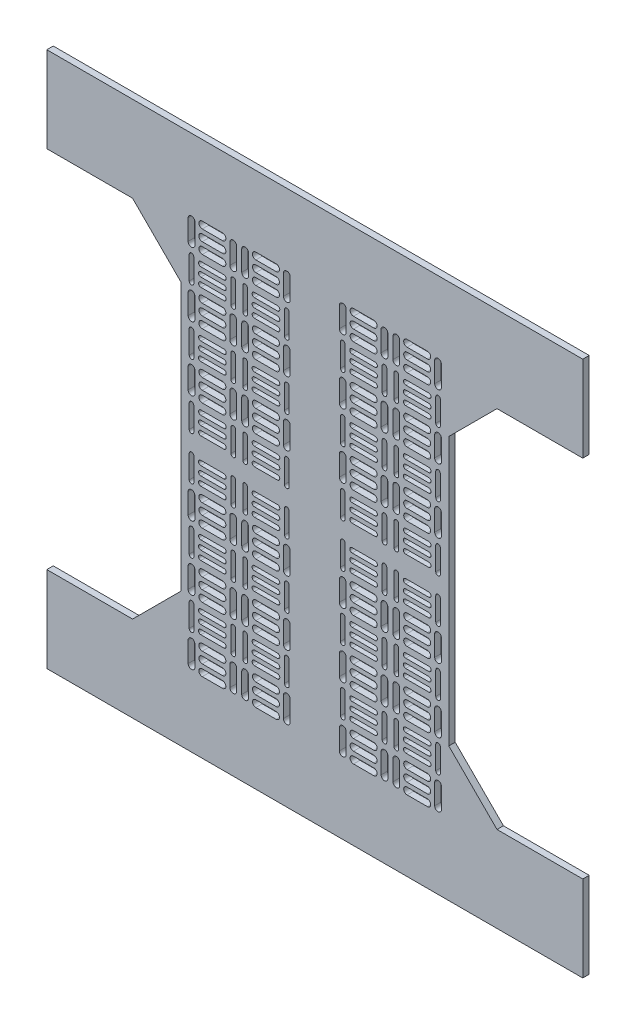
from build123d import *

# Parameters (mm, degrees)
BOSS_EXTRU_1_DEPTH              = 3
ENL_V_MAT_EXTRU_1_DEPTH         = 177.802149308
R_P_TITION_LIN_AIRE1_COUNT      = 2
R_P_TITION_LIN_AIRE1_PITCH      = 25
R_P_TITION_LIN_AIRE1_COUNT_DIR2 = 3
R_P_TITION_LIN_AIRE1_PITCH_DIR2 = 30
SYM_TRIE1_COPY_1_DEPTH          = 177.802149308
SYM_TRIE1_COPY_2_DEPTH          = 177.802149308
SYM_TRIE1_COPY_3_DEPTH          = 177.802149308
SYM_TRIE1_COPY_4_DEPTH          = 177.802149308
SYM_TRIE1_COPY_5_DEPTH          = 177.802149308
SYM_TRIE2_COPY_1_DEPTH          = 177.802149308
SYM_TRIE2_COPY_2_DEPTH          = 177.802149308
SYM_TRIE2_COPY_3_DEPTH          = 177.802149308
SYM_TRIE2_COPY_4_DEPTH          = 177.802149308
SYM_TRIE2_COPY_5_DEPTH          = 177.802149308
SYM_TRIE2_COPY_6_DEPTH          = 3
SYM_TRIE2_COPY_7_DEPTH          = 177.802149308
SYM_TRIE2_COPY_8_DEPTH          = 177.802149308
SYM_TRIE2_COPY_9_DEPTH          = 177.802149308
SYM_TRIE2_COPY_10_DEPTH         = 177.802149308
SYM_TRIE2_COPY_11_DEPTH         = 177.802149308
SYM_TRIE2_COPY_12_DEPTH         = 177.802149308


with BuildPart() as part:
    # Esquisse1 → Boss.-Extru.1 (new body)
    with BuildSketch(Plane.XY):
        Polygon((0, 0), (0, 125), (125, 125), (125, 85), (85, 85), (62.5, 62.5), (62.5, 0), align=None)
    boss_extru_1 = extrude(amount=BOSS_EXTRU_1_DEPTH)

    # Esquisse2 → Enlèv. mat.-Extru.1 (cut, symmetric)
    with BuildSketch(Plane.XY.offset(3)):
        with BuildLine():
            Line((43.05, 83.7), (52.5, 83.7))
            ThreePointArc((52.5, 83.7), (54.075, 85.275), (52.5, 86.85))
            Line((52.5, 86.85), (43.05, 86.85))
            ThreePointArc((43.05, 86.85), (41.475, 85.275), (43.05, 83.7))
        make_face()
        with BuildLine():
            Line((43.05, 92), (52.5, 92))
            ThreePointArc((52.5, 92), (54.075, 90.425), (52.5, 88.85))
            Line((52.5, 88.85), (43.05, 88.85))
            ThreePointArc((43.05, 88.85), (41.475, 90.425), (43.05, 92))
        make_face()
        with BuildLine():
            Line((59.075, 90), (59.075, 80.55))
            ThreePointArc((59.075, 80.55), (57.5, 78.975), (55.925, 80.55))
            Line((55.925, 80.55), (55.925, 90))
            ThreePointArc((55.925, 90), (57.5, 91.575), (59.075, 90))
        make_face()
        with BuildLine():
            Line((43.05, 78.55), (52.5, 78.55))
            ThreePointArc((52.5, 78.55), (54.075, 80.125), (52.5, 81.7))
            Line((52.5, 81.7), (43.05, 81.7))
            ThreePointArc((43.05, 81.7), (41.475, 80.125), (43.05, 78.55))
        make_face()
        with BuildLine():
            Line((42.4, 75.4), (53.15, 75.4))
            ThreePointArc((53.15, 75.4), (54.225, 74.325), (53.15, 73.25))
            Line((53.15, 73.25), (42.4, 73.25))
            ThreePointArc((42.4, 73.25), (41.325, 74.325), (42.4, 75.4))
        make_face()
        with BuildLine():
            Line((36.475, 90), (36.475, 80.55))
            ThreePointArc((36.475, 80.55), (38.05, 78.975), (39.625, 80.55))
            Line((39.625, 80.55), (39.625, 90))
            ThreePointArc((39.625, 90), (38.05, 91.575), (36.475, 90))
        make_face()
        with BuildLine():
            Line((56.425, 75.55), (56.425, 64.8))
            ThreePointArc((56.425, 64.8), (57.5, 63.725), (58.575, 64.8))
            Line((58.575, 64.8), (58.575, 75.55))
            ThreePointArc((58.575, 75.55), (57.5, 76.625), (56.425, 75.55))
        make_face()
        with BuildLine():
            Line((42.4, 69.1), (53.15, 69.1))
            ThreePointArc((53.15, 69.1), (54.225, 70.175), (53.15, 71.25))
            Line((53.15, 71.25), (42.4, 71.25))
            ThreePointArc((42.4, 71.25), (41.325, 70.175), (42.4, 69.1))
        make_face()
        with BuildLine():
            Line((42.4, 64.95), (53.15, 64.95))
            ThreePointArc((53.15, 64.95), (54.225, 66.025), (53.15, 67.1))
            Line((53.15, 67.1), (42.4, 67.1))
            ThreePointArc((42.4, 67.1), (41.325, 66.025), (42.4, 64.95))
        make_face()
        with BuildLine():
            Line((39.125, 75.55), (39.125, 64.8))
            ThreePointArc((39.125, 64.8), (38.05, 63.725), (36.975, 64.8))
            Line((36.975, 64.8), (36.975, 75.55))
            ThreePointArc((36.975, 75.55), (38.05, 76.625), (39.125, 75.55))
        make_face()
    enl_v_mat_extru_1 = extrude(amount=ENL_V_MAT_EXTRU_1_DEPTH, both=True, mode=Mode.SUBTRACT)

    # Répétition linéaire1: Enl_v. mat.-Extru.1 2 × 3
    with Locations(*[(-i * R_P_TITION_LIN_AIRE1_PITCH, -j * R_P_TITION_LIN_AIRE1_PITCH_DIR2, 0) for i in range(R_P_TITION_LIN_AIRE1_COUNT) for j in range(R_P_TITION_LIN_AIRE1_COUNT_DIR2) if (i, j) != (0, 0)]):
        add(enl_v_mat_extru_1, mode=Mode.SUBTRACT)

    # Symétrie1: Boss.-Extru.1, Enlèv. mat.-Extru.1 across plane
    add(boss_extru_1.mirror(Plane.ZX))
    add(enl_v_mat_extru_1.mirror(Plane.ZX), mode=Mode.SUBTRACT)

    # Symétrie1 copy 1 sketch → Symétrie1 copy 1 (cut, symmetric)
    with BuildSketch(Plane(origin=(0, 30, 3), x_dir=(1, 0, 0), z_dir=(0, 0, 1))):
        with BuildLine():
            Line((43.05, -83.7), (52.5, -83.7))
            ThreePointArc((52.5, -83.7), (54.075, -85.275), (52.5, -86.85))
            Line((52.5, -86.85), (43.05, -86.85))
            ThreePointArc((43.05, -86.85), (41.475, -85.275), (43.05, -83.7))
        make_face()
        with BuildLine():
            Line((43.05, -92), (52.5, -92))
            ThreePointArc((52.5, -92), (54.075, -90.425), (52.5, -88.85))
            Line((52.5, -88.85), (43.05, -88.85))
            ThreePointArc((43.05, -88.85), (41.475, -90.425), (43.05, -92))
        make_face()
        with BuildLine():
            Line((59.075, -90), (59.075, -80.55))
            ThreePointArc((59.075, -80.55), (57.5, -78.975), (55.925, -80.55))
            Line((55.925, -80.55), (55.925, -90))
            ThreePointArc((55.925, -90), (57.5, -91.575), (59.075, -90))
        make_face()
        with BuildLine():
            Line((43.05, -78.55), (52.5, -78.55))
            ThreePointArc((52.5, -78.55), (54.075, -80.125), (52.5, -81.7))
            Line((52.5, -81.7), (43.05, -81.7))
            ThreePointArc((43.05, -81.7), (41.475, -80.125), (43.05, -78.55))
        make_face()
        with BuildLine():
            Line((42.4, -75.4), (53.15, -75.4))
            ThreePointArc((53.15, -75.4), (54.225, -74.325), (53.15, -73.25))
            Line((53.15, -73.25), (42.4, -73.25))
            ThreePointArc((42.4, -73.25), (41.325, -74.325), (42.4, -75.4))
        make_face()
        with BuildLine():
            Line((36.475, -90), (36.475, -80.55))
            ThreePointArc((36.475, -80.55), (38.05, -78.975), (39.625, -80.55))
            Line((39.625, -80.55), (39.625, -90))
            ThreePointArc((39.625, -90), (38.05, -91.575), (36.475, -90))
        make_face()
        with BuildLine():
            Line((56.425, -75.55), (56.425, -64.8))
            ThreePointArc((56.425, -64.8), (57.5, -63.725), (58.575, -64.8))
            Line((58.575, -64.8), (58.575, -75.55))
            ThreePointArc((58.575, -75.55), (57.5, -76.625), (56.425, -75.55))
        make_face()
        with BuildLine():
            Line((42.4, -69.1), (53.15, -69.1))
            ThreePointArc((53.15, -69.1), (54.225, -70.175), (53.15, -71.25))
            Line((53.15, -71.25), (42.4, -71.25))
            ThreePointArc((42.4, -71.25), (41.325, -70.175), (42.4, -69.1))
        make_face()
        with BuildLine():
            Line((42.4, -64.95), (53.15, -64.95))
            ThreePointArc((53.15, -64.95), (54.225, -66.025), (53.15, -67.1))
            Line((53.15, -67.1), (42.4, -67.1))
            ThreePointArc((42.4, -67.1), (41.325, -66.025), (42.4, -64.95))
        make_face()
        with BuildLine():
            Line((39.125, -75.55), (39.125, -64.8))
            ThreePointArc((39.125, -64.8), (38.05, -63.725), (36.975, -64.8))
            Line((36.975, -64.8), (36.975, -75.55))
            ThreePointArc((36.975, -75.55), (38.05, -76.625), (39.125, -75.55))
        make_face()
    extrude(amount=SYM_TRIE1_COPY_1_DEPTH, both=True, mode=Mode.SUBTRACT)

    # Symétrie1 copy 2 sketch → Symétrie1 copy 2 (cut, symmetric)
    with BuildSketch(Plane(origin=(0, 60, 3), x_dir=(1, 0, 0), z_dir=(0, 0, 1))):
        with BuildLine():
            Line((43.05, -83.7), (52.5, -83.7))
            ThreePointArc((52.5, -83.7), (54.075, -85.275), (52.5, -86.85))
            Line((52.5, -86.85), (43.05, -86.85))
            ThreePointArc((43.05, -86.85), (41.475, -85.275), (43.05, -83.7))
        make_face()
        with BuildLine():
            Line((43.05, -92), (52.5, -92))
            ThreePointArc((52.5, -92), (54.075, -90.425), (52.5, -88.85))
            Line((52.5, -88.85), (43.05, -88.85))
            ThreePointArc((43.05, -88.85), (41.475, -90.425), (43.05, -92))
        make_face()
        with BuildLine():
            Line((59.075, -90), (59.075, -80.55))
            ThreePointArc((59.075, -80.55), (57.5, -78.975), (55.925, -80.55))
            Line((55.925, -80.55), (55.925, -90))
            ThreePointArc((55.925, -90), (57.5, -91.575), (59.075, -90))
        make_face()
        with BuildLine():
            Line((43.05, -78.55), (52.5, -78.55))
            ThreePointArc((52.5, -78.55), (54.075, -80.125), (52.5, -81.7))
            Line((52.5, -81.7), (43.05, -81.7))
            ThreePointArc((43.05, -81.7), (41.475, -80.125), (43.05, -78.55))
        make_face()
        with BuildLine():
            Line((42.4, -75.4), (53.15, -75.4))
            ThreePointArc((53.15, -75.4), (54.225, -74.325), (53.15, -73.25))
            Line((53.15, -73.25), (42.4, -73.25))
            ThreePointArc((42.4, -73.25), (41.325, -74.325), (42.4, -75.4))
        make_face()
        with BuildLine():
            Line((36.475, -90), (36.475, -80.55))
            ThreePointArc((36.475, -80.55), (38.05, -78.975), (39.625, -80.55))
            Line((39.625, -80.55), (39.625, -90))
            ThreePointArc((39.625, -90), (38.05, -91.575), (36.475, -90))
        make_face()
        with BuildLine():
            Line((56.425, -75.55), (56.425, -64.8))
            ThreePointArc((56.425, -64.8), (57.5, -63.725), (58.575, -64.8))
            Line((58.575, -64.8), (58.575, -75.55))
            ThreePointArc((58.575, -75.55), (57.5, -76.625), (56.425, -75.55))
        make_face()
        with BuildLine():
            Line((42.4, -69.1), (53.15, -69.1))
            ThreePointArc((53.15, -69.1), (54.225, -70.175), (53.15, -71.25))
            Line((53.15, -71.25), (42.4, -71.25))
            ThreePointArc((42.4, -71.25), (41.325, -70.175), (42.4, -69.1))
        make_face()
        with BuildLine():
            Line((42.4, -64.95), (53.15, -64.95))
            ThreePointArc((53.15, -64.95), (54.225, -66.025), (53.15, -67.1))
            Line((53.15, -67.1), (42.4, -67.1))
            ThreePointArc((42.4, -67.1), (41.325, -66.025), (42.4, -64.95))
        make_face()
        with BuildLine():
            Line((39.125, -75.55), (39.125, -64.8))
            ThreePointArc((39.125, -64.8), (38.05, -63.725), (36.975, -64.8))
            Line((36.975, -64.8), (36.975, -75.55))
            ThreePointArc((36.975, -75.55), (38.05, -76.625), (39.125, -75.55))
        make_face()
    extrude(amount=SYM_TRIE1_COPY_2_DEPTH, both=True, mode=Mode.SUBTRACT)

    # Symétrie1 copy 3 sketch → Symétrie1 copy 3 (cut, symmetric)
    with BuildSketch(Plane(origin=(-25, 0, 3), x_dir=(1, 0, 0), z_dir=(0, 0, 1))):
        with BuildLine():
            Line((43.05, -83.7), (52.5, -83.7))
            ThreePointArc((52.5, -83.7), (54.075, -85.275), (52.5, -86.85))
            Line((52.5, -86.85), (43.05, -86.85))
            ThreePointArc((43.05, -86.85), (41.475, -85.275), (43.05, -83.7))
        make_face()
        with BuildLine():
            Line((43.05, -92), (52.5, -92))
            ThreePointArc((52.5, -92), (54.075, -90.425), (52.5, -88.85))
            Line((52.5, -88.85), (43.05, -88.85))
            ThreePointArc((43.05, -88.85), (41.475, -90.425), (43.05, -92))
        make_face()
        with BuildLine():
            Line((59.075, -90), (59.075, -80.55))
            ThreePointArc((59.075, -80.55), (57.5, -78.975), (55.925, -80.55))
            Line((55.925, -80.55), (55.925, -90))
            ThreePointArc((55.925, -90), (57.5, -91.575), (59.075, -90))
        make_face()
        with BuildLine():
            Line((43.05, -78.55), (52.5, -78.55))
            ThreePointArc((52.5, -78.55), (54.075, -80.125), (52.5, -81.7))
            Line((52.5, -81.7), (43.05, -81.7))
            ThreePointArc((43.05, -81.7), (41.475, -80.125), (43.05, -78.55))
        make_face()
        with BuildLine():
            Line((42.4, -75.4), (53.15, -75.4))
            ThreePointArc((53.15, -75.4), (54.225, -74.325), (53.15, -73.25))
            Line((53.15, -73.25), (42.4, -73.25))
            ThreePointArc((42.4, -73.25), (41.325, -74.325), (42.4, -75.4))
        make_face()
        with BuildLine():
            Line((36.475, -90), (36.475, -80.55))
            ThreePointArc((36.475, -80.55), (38.05, -78.975), (39.625, -80.55))
            Line((39.625, -80.55), (39.625, -90))
            ThreePointArc((39.625, -90), (38.05, -91.575), (36.475, -90))
        make_face()
        with BuildLine():
            Line((56.425, -75.55), (56.425, -64.8))
            ThreePointArc((56.425, -64.8), (57.5, -63.725), (58.575, -64.8))
            Line((58.575, -64.8), (58.575, -75.55))
            ThreePointArc((58.575, -75.55), (57.5, -76.625), (56.425, -75.55))
        make_face()
        with BuildLine():
            Line((42.4, -69.1), (53.15, -69.1))
            ThreePointArc((53.15, -69.1), (54.225, -70.175), (53.15, -71.25))
            Line((53.15, -71.25), (42.4, -71.25))
            ThreePointArc((42.4, -71.25), (41.325, -70.175), (42.4, -69.1))
        make_face()
        with BuildLine():
            Line((42.4, -64.95), (53.15, -64.95))
            ThreePointArc((53.15, -64.95), (54.225, -66.025), (53.15, -67.1))
            Line((53.15, -67.1), (42.4, -67.1))
            ThreePointArc((42.4, -67.1), (41.325, -66.025), (42.4, -64.95))
        make_face()
        with BuildLine():
            Line((39.125, -75.55), (39.125, -64.8))
            ThreePointArc((39.125, -64.8), (38.05, -63.725), (36.975, -64.8))
            Line((36.975, -64.8), (36.975, -75.55))
            ThreePointArc((36.975, -75.55), (38.05, -76.625), (39.125, -75.55))
        make_face()
    extrude(amount=SYM_TRIE1_COPY_3_DEPTH, both=True, mode=Mode.SUBTRACT)

    # Symétrie1 copy 4 sketch → Symétrie1 copy 4 (cut, symmetric)
    with BuildSketch(Plane(origin=(-25, 30, 3), x_dir=(1, 0, 0), z_dir=(0, 0, 1))):
        with BuildLine():
            Line((43.05, -83.7), (52.5, -83.7))
            ThreePointArc((52.5, -83.7), (54.075, -85.275), (52.5, -86.85))
            Line((52.5, -86.85), (43.05, -86.85))
            ThreePointArc((43.05, -86.85), (41.475, -85.275), (43.05, -83.7))
        make_face()
        with BuildLine():
            Line((43.05, -92), (52.5, -92))
            ThreePointArc((52.5, -92), (54.075, -90.425), (52.5, -88.85))
            Line((52.5, -88.85), (43.05, -88.85))
            ThreePointArc((43.05, -88.85), (41.475, -90.425), (43.05, -92))
        make_face()
        with BuildLine():
            Line((59.075, -90), (59.075, -80.55))
            ThreePointArc((59.075, -80.55), (57.5, -78.975), (55.925, -80.55))
            Line((55.925, -80.55), (55.925, -90))
            ThreePointArc((55.925, -90), (57.5, -91.575), (59.075, -90))
        make_face()
        with BuildLine():
            Line((43.05, -78.55), (52.5, -78.55))
            ThreePointArc((52.5, -78.55), (54.075, -80.125), (52.5, -81.7))
            Line((52.5, -81.7), (43.05, -81.7))
            ThreePointArc((43.05, -81.7), (41.475, -80.125), (43.05, -78.55))
        make_face()
        with BuildLine():
            Line((42.4, -75.4), (53.15, -75.4))
            ThreePointArc((53.15, -75.4), (54.225, -74.325), (53.15, -73.25))
            Line((53.15, -73.25), (42.4, -73.25))
            ThreePointArc((42.4, -73.25), (41.325, -74.325), (42.4, -75.4))
        make_face()
        with BuildLine():
            Line((36.475, -90), (36.475, -80.55))
            ThreePointArc((36.475, -80.55), (38.05, -78.975), (39.625, -80.55))
            Line((39.625, -80.55), (39.625, -90))
            ThreePointArc((39.625, -90), (38.05, -91.575), (36.475, -90))
        make_face()
        with BuildLine():
            Line((56.425, -75.55), (56.425, -64.8))
            ThreePointArc((56.425, -64.8), (57.5, -63.725), (58.575, -64.8))
            Line((58.575, -64.8), (58.575, -75.55))
            ThreePointArc((58.575, -75.55), (57.5, -76.625), (56.425, -75.55))
        make_face()
        with BuildLine():
            Line((42.4, -69.1), (53.15, -69.1))
            ThreePointArc((53.15, -69.1), (54.225, -70.175), (53.15, -71.25))
            Line((53.15, -71.25), (42.4, -71.25))
            ThreePointArc((42.4, -71.25), (41.325, -70.175), (42.4, -69.1))
        make_face()
        with BuildLine():
            Line((42.4, -64.95), (53.15, -64.95))
            ThreePointArc((53.15, -64.95), (54.225, -66.025), (53.15, -67.1))
            Line((53.15, -67.1), (42.4, -67.1))
            ThreePointArc((42.4, -67.1), (41.325, -66.025), (42.4, -64.95))
        make_face()
        with BuildLine():
            Line((39.125, -75.55), (39.125, -64.8))
            ThreePointArc((39.125, -64.8), (38.05, -63.725), (36.975, -64.8))
            Line((36.975, -64.8), (36.975, -75.55))
            ThreePointArc((36.975, -75.55), (38.05, -76.625), (39.125, -75.55))
        make_face()
    extrude(amount=SYM_TRIE1_COPY_4_DEPTH, both=True, mode=Mode.SUBTRACT)

    # Symétrie1 copy 5 sketch → Symétrie1 copy 5 (cut, symmetric)
    with BuildSketch(Plane(origin=(-25, 60, 3), x_dir=(1, 0, 0), z_dir=(0, 0, 1))):
        with BuildLine():
            Line((43.05, -83.7), (52.5, -83.7))
            ThreePointArc((52.5, -83.7), (54.075, -85.275), (52.5, -86.85))
            Line((52.5, -86.85), (43.05, -86.85))
            ThreePointArc((43.05, -86.85), (41.475, -85.275), (43.05, -83.7))
        make_face()
        with BuildLine():
            Line((43.05, -92), (52.5, -92))
            ThreePointArc((52.5, -92), (54.075, -90.425), (52.5, -88.85))
            Line((52.5, -88.85), (43.05, -88.85))
            ThreePointArc((43.05, -88.85), (41.475, -90.425), (43.05, -92))
        make_face()
        with BuildLine():
            Line((59.075, -90), (59.075, -80.55))
            ThreePointArc((59.075, -80.55), (57.5, -78.975), (55.925, -80.55))
            Line((55.925, -80.55), (55.925, -90))
            ThreePointArc((55.925, -90), (57.5, -91.575), (59.075, -90))
        make_face()
        with BuildLine():
            Line((43.05, -78.55), (52.5, -78.55))
            ThreePointArc((52.5, -78.55), (54.075, -80.125), (52.5, -81.7))
            Line((52.5, -81.7), (43.05, -81.7))
            ThreePointArc((43.05, -81.7), (41.475, -80.125), (43.05, -78.55))
        make_face()
        with BuildLine():
            Line((42.4, -75.4), (53.15, -75.4))
            ThreePointArc((53.15, -75.4), (54.225, -74.325), (53.15, -73.25))
            Line((53.15, -73.25), (42.4, -73.25))
            ThreePointArc((42.4, -73.25), (41.325, -74.325), (42.4, -75.4))
        make_face()
        with BuildLine():
            Line((36.475, -90), (36.475, -80.55))
            ThreePointArc((36.475, -80.55), (38.05, -78.975), (39.625, -80.55))
            Line((39.625, -80.55), (39.625, -90))
            ThreePointArc((39.625, -90), (38.05, -91.575), (36.475, -90))
        make_face()
        with BuildLine():
            Line((56.425, -75.55), (56.425, -64.8))
            ThreePointArc((56.425, -64.8), (57.5, -63.725), (58.575, -64.8))
            Line((58.575, -64.8), (58.575, -75.55))
            ThreePointArc((58.575, -75.55), (57.5, -76.625), (56.425, -75.55))
        make_face()
        with BuildLine():
            Line((42.4, -69.1), (53.15, -69.1))
            ThreePointArc((53.15, -69.1), (54.225, -70.175), (53.15, -71.25))
            Line((53.15, -71.25), (42.4, -71.25))
            ThreePointArc((42.4, -71.25), (41.325, -70.175), (42.4, -69.1))
        make_face()
        with BuildLine():
            Line((42.4, -64.95), (53.15, -64.95))
            ThreePointArc((53.15, -64.95), (54.225, -66.025), (53.15, -67.1))
            Line((53.15, -67.1), (42.4, -67.1))
            ThreePointArc((42.4, -67.1), (41.325, -66.025), (42.4, -64.95))
        make_face()
        with BuildLine():
            Line((39.125, -75.55), (39.125, -64.8))
            ThreePointArc((39.125, -64.8), (38.05, -63.725), (36.975, -64.8))
            Line((36.975, -64.8), (36.975, -75.55))
            ThreePointArc((36.975, -75.55), (38.05, -76.625), (39.125, -75.55))
        make_face()
    extrude(amount=SYM_TRIE1_COPY_5_DEPTH, both=True, mode=Mode.SUBTRACT)

    # Symétrie2: Boss.-Extru.1, Enlèv. mat.-Extru.1 across plane
    add(boss_extru_1.mirror(Plane(origin=(0, 0, 0), x_dir=(0, 0, 1), z_dir=(1, 0, 0))))
    add(enl_v_mat_extru_1.mirror(Plane(origin=(0, 0, 0), x_dir=(0, 0, 1), z_dir=(1, 0, 0))), mode=Mode.SUBTRACT)

    # Symétrie2 copy 1 sketch → Symétrie2 copy 1 (cut, symmetric)
    with BuildSketch(Plane(origin=(0, -30, 3), x_dir=(-1, 0, 0), z_dir=(0, 0, 1))):
        with BuildLine():
            Line((43.05, -83.7), (52.5, -83.7))
            ThreePointArc((52.5, -83.7), (54.075, -85.275), (52.5, -86.85))
            Line((52.5, -86.85), (43.05, -86.85))
            ThreePointArc((43.05, -86.85), (41.475, -85.275), (43.05, -83.7))
        make_face()
        with BuildLine():
            Line((43.05, -92), (52.5, -92))
            ThreePointArc((52.5, -92), (54.075, -90.425), (52.5, -88.85))
            Line((52.5, -88.85), (43.05, -88.85))
            ThreePointArc((43.05, -88.85), (41.475, -90.425), (43.05, -92))
        make_face()
        with BuildLine():
            Line((59.075, -90), (59.075, -80.55))
            ThreePointArc((59.075, -80.55), (57.5, -78.975), (55.925, -80.55))
            Line((55.925, -80.55), (55.925, -90))
            ThreePointArc((55.925, -90), (57.5, -91.575), (59.075, -90))
        make_face()
        with BuildLine():
            Line((43.05, -78.55), (52.5, -78.55))
            ThreePointArc((52.5, -78.55), (54.075, -80.125), (52.5, -81.7))
            Line((52.5, -81.7), (43.05, -81.7))
            ThreePointArc((43.05, -81.7), (41.475, -80.125), (43.05, -78.55))
        make_face()
        with BuildLine():
            Line((42.4, -75.4), (53.15, -75.4))
            ThreePointArc((53.15, -75.4), (54.225, -74.325), (53.15, -73.25))
            Line((53.15, -73.25), (42.4, -73.25))
            ThreePointArc((42.4, -73.25), (41.325, -74.325), (42.4, -75.4))
        make_face()
        with BuildLine():
            Line((36.475, -90), (36.475, -80.55))
            ThreePointArc((36.475, -80.55), (38.05, -78.975), (39.625, -80.55))
            Line((39.625, -80.55), (39.625, -90))
            ThreePointArc((39.625, -90), (38.05, -91.575), (36.475, -90))
        make_face()
        with BuildLine():
            Line((56.425, -75.55), (56.425, -64.8))
            ThreePointArc((56.425, -64.8), (57.5, -63.725), (58.575, -64.8))
            Line((58.575, -64.8), (58.575, -75.55))
            ThreePointArc((58.575, -75.55), (57.5, -76.625), (56.425, -75.55))
        make_face()
        with BuildLine():
            Line((42.4, -69.1), (53.15, -69.1))
            ThreePointArc((53.15, -69.1), (54.225, -70.175), (53.15, -71.25))
            Line((53.15, -71.25), (42.4, -71.25))
            ThreePointArc((42.4, -71.25), (41.325, -70.175), (42.4, -69.1))
        make_face()
        with BuildLine():
            Line((42.4, -64.95), (53.15, -64.95))
            ThreePointArc((53.15, -64.95), (54.225, -66.025), (53.15, -67.1))
            Line((53.15, -67.1), (42.4, -67.1))
            ThreePointArc((42.4, -67.1), (41.325, -66.025), (42.4, -64.95))
        make_face()
        with BuildLine():
            Line((39.125, -75.55), (39.125, -64.8))
            ThreePointArc((39.125, -64.8), (38.05, -63.725), (36.975, -64.8))
            Line((36.975, -64.8), (36.975, -75.55))
            ThreePointArc((36.975, -75.55), (38.05, -76.625), (39.125, -75.55))
        make_face()
    extrude(amount=SYM_TRIE2_COPY_1_DEPTH, both=True, mode=Mode.SUBTRACT)

    # Symétrie2 copy 2 sketch → Symétrie2 copy 2 (cut, symmetric)
    with BuildSketch(Plane(origin=(0, -60, 3), x_dir=(-1, 0, 0), z_dir=(0, 0, 1))):
        with BuildLine():
            Line((43.05, -83.7), (52.5, -83.7))
            ThreePointArc((52.5, -83.7), (54.075, -85.275), (52.5, -86.85))
            Line((52.5, -86.85), (43.05, -86.85))
            ThreePointArc((43.05, -86.85), (41.475, -85.275), (43.05, -83.7))
        make_face()
        with BuildLine():
            Line((43.05, -92), (52.5, -92))
            ThreePointArc((52.5, -92), (54.075, -90.425), (52.5, -88.85))
            Line((52.5, -88.85), (43.05, -88.85))
            ThreePointArc((43.05, -88.85), (41.475, -90.425), (43.05, -92))
        make_face()
        with BuildLine():
            Line((59.075, -90), (59.075, -80.55))
            ThreePointArc((59.075, -80.55), (57.5, -78.975), (55.925, -80.55))
            Line((55.925, -80.55), (55.925, -90))
            ThreePointArc((55.925, -90), (57.5, -91.575), (59.075, -90))
        make_face()
        with BuildLine():
            Line((43.05, -78.55), (52.5, -78.55))
            ThreePointArc((52.5, -78.55), (54.075, -80.125), (52.5, -81.7))
            Line((52.5, -81.7), (43.05, -81.7))
            ThreePointArc((43.05, -81.7), (41.475, -80.125), (43.05, -78.55))
        make_face()
        with BuildLine():
            Line((42.4, -75.4), (53.15, -75.4))
            ThreePointArc((53.15, -75.4), (54.225, -74.325), (53.15, -73.25))
            Line((53.15, -73.25), (42.4, -73.25))
            ThreePointArc((42.4, -73.25), (41.325, -74.325), (42.4, -75.4))
        make_face()
        with BuildLine():
            Line((36.475, -90), (36.475, -80.55))
            ThreePointArc((36.475, -80.55), (38.05, -78.975), (39.625, -80.55))
            Line((39.625, -80.55), (39.625, -90))
            ThreePointArc((39.625, -90), (38.05, -91.575), (36.475, -90))
        make_face()
        with BuildLine():
            Line((56.425, -75.55), (56.425, -64.8))
            ThreePointArc((56.425, -64.8), (57.5, -63.725), (58.575, -64.8))
            Line((58.575, -64.8), (58.575, -75.55))
            ThreePointArc((58.575, -75.55), (57.5, -76.625), (56.425, -75.55))
        make_face()
        with BuildLine():
            Line((42.4, -69.1), (53.15, -69.1))
            ThreePointArc((53.15, -69.1), (54.225, -70.175), (53.15, -71.25))
            Line((53.15, -71.25), (42.4, -71.25))
            ThreePointArc((42.4, -71.25), (41.325, -70.175), (42.4, -69.1))
        make_face()
        with BuildLine():
            Line((42.4, -64.95), (53.15, -64.95))
            ThreePointArc((53.15, -64.95), (54.225, -66.025), (53.15, -67.1))
            Line((53.15, -67.1), (42.4, -67.1))
            ThreePointArc((42.4, -67.1), (41.325, -66.025), (42.4, -64.95))
        make_face()
        with BuildLine():
            Line((39.125, -75.55), (39.125, -64.8))
            ThreePointArc((39.125, -64.8), (38.05, -63.725), (36.975, -64.8))
            Line((36.975, -64.8), (36.975, -75.55))
            ThreePointArc((36.975, -75.55), (38.05, -76.625), (39.125, -75.55))
        make_face()
    extrude(amount=SYM_TRIE2_COPY_2_DEPTH, both=True, mode=Mode.SUBTRACT)

    # Symétrie2 copy 3 sketch → Symétrie2 copy 3 (cut, symmetric)
    with BuildSketch(Plane(origin=(25, 0, 3), x_dir=(-1, 0, 0), z_dir=(0, 0, 1))):
        with BuildLine():
            Line((43.05, -83.7), (52.5, -83.7))
            ThreePointArc((52.5, -83.7), (54.075, -85.275), (52.5, -86.85))
            Line((52.5, -86.85), (43.05, -86.85))
            ThreePointArc((43.05, -86.85), (41.475, -85.275), (43.05, -83.7))
        make_face()
        with BuildLine():
            Line((43.05, -92), (52.5, -92))
            ThreePointArc((52.5, -92), (54.075, -90.425), (52.5, -88.85))
            Line((52.5, -88.85), (43.05, -88.85))
            ThreePointArc((43.05, -88.85), (41.475, -90.425), (43.05, -92))
        make_face()
        with BuildLine():
            Line((59.075, -90), (59.075, -80.55))
            ThreePointArc((59.075, -80.55), (57.5, -78.975), (55.925, -80.55))
            Line((55.925, -80.55), (55.925, -90))
            ThreePointArc((55.925, -90), (57.5, -91.575), (59.075, -90))
        make_face()
        with BuildLine():
            Line((43.05, -78.55), (52.5, -78.55))
            ThreePointArc((52.5, -78.55), (54.075, -80.125), (52.5, -81.7))
            Line((52.5, -81.7), (43.05, -81.7))
            ThreePointArc((43.05, -81.7), (41.475, -80.125), (43.05, -78.55))
        make_face()
        with BuildLine():
            Line((42.4, -75.4), (53.15, -75.4))
            ThreePointArc((53.15, -75.4), (54.225, -74.325), (53.15, -73.25))
            Line((53.15, -73.25), (42.4, -73.25))
            ThreePointArc((42.4, -73.25), (41.325, -74.325), (42.4, -75.4))
        make_face()
        with BuildLine():
            Line((36.475, -90), (36.475, -80.55))
            ThreePointArc((36.475, -80.55), (38.05, -78.975), (39.625, -80.55))
            Line((39.625, -80.55), (39.625, -90))
            ThreePointArc((39.625, -90), (38.05, -91.575), (36.475, -90))
        make_face()
        with BuildLine():
            Line((56.425, -75.55), (56.425, -64.8))
            ThreePointArc((56.425, -64.8), (57.5, -63.725), (58.575, -64.8))
            Line((58.575, -64.8), (58.575, -75.55))
            ThreePointArc((58.575, -75.55), (57.5, -76.625), (56.425, -75.55))
        make_face()
        with BuildLine():
            Line((42.4, -69.1), (53.15, -69.1))
            ThreePointArc((53.15, -69.1), (54.225, -70.175), (53.15, -71.25))
            Line((53.15, -71.25), (42.4, -71.25))
            ThreePointArc((42.4, -71.25), (41.325, -70.175), (42.4, -69.1))
        make_face()
        with BuildLine():
            Line((42.4, -64.95), (53.15, -64.95))
            ThreePointArc((53.15, -64.95), (54.225, -66.025), (53.15, -67.1))
            Line((53.15, -67.1), (42.4, -67.1))
            ThreePointArc((42.4, -67.1), (41.325, -66.025), (42.4, -64.95))
        make_face()
        with BuildLine():
            Line((39.125, -75.55), (39.125, -64.8))
            ThreePointArc((39.125, -64.8), (38.05, -63.725), (36.975, -64.8))
            Line((36.975, -64.8), (36.975, -75.55))
            ThreePointArc((36.975, -75.55), (38.05, -76.625), (39.125, -75.55))
        make_face()
    extrude(amount=SYM_TRIE2_COPY_3_DEPTH, both=True, mode=Mode.SUBTRACT)

    # Symétrie2 copy 4 sketch → Symétrie2 copy 4 (cut, symmetric)
    with BuildSketch(Plane(origin=(25, -30, 3), x_dir=(-1, 0, 0), z_dir=(0, 0, 1))):
        with BuildLine():
            Line((43.05, -83.7), (52.5, -83.7))
            ThreePointArc((52.5, -83.7), (54.075, -85.275), (52.5, -86.85))
            Line((52.5, -86.85), (43.05, -86.85))
            ThreePointArc((43.05, -86.85), (41.475, -85.275), (43.05, -83.7))
        make_face()
        with BuildLine():
            Line((43.05, -92), (52.5, -92))
            ThreePointArc((52.5, -92), (54.075, -90.425), (52.5, -88.85))
            Line((52.5, -88.85), (43.05, -88.85))
            ThreePointArc((43.05, -88.85), (41.475, -90.425), (43.05, -92))
        make_face()
        with BuildLine():
            Line((59.075, -90), (59.075, -80.55))
            ThreePointArc((59.075, -80.55), (57.5, -78.975), (55.925, -80.55))
            Line((55.925, -80.55), (55.925, -90))
            ThreePointArc((55.925, -90), (57.5, -91.575), (59.075, -90))
        make_face()
        with BuildLine():
            Line((43.05, -78.55), (52.5, -78.55))
            ThreePointArc((52.5, -78.55), (54.075, -80.125), (52.5, -81.7))
            Line((52.5, -81.7), (43.05, -81.7))
            ThreePointArc((43.05, -81.7), (41.475, -80.125), (43.05, -78.55))
        make_face()
        with BuildLine():
            Line((42.4, -75.4), (53.15, -75.4))
            ThreePointArc((53.15, -75.4), (54.225, -74.325), (53.15, -73.25))
            Line((53.15, -73.25), (42.4, -73.25))
            ThreePointArc((42.4, -73.25), (41.325, -74.325), (42.4, -75.4))
        make_face()
        with BuildLine():
            Line((36.475, -90), (36.475, -80.55))
            ThreePointArc((36.475, -80.55), (38.05, -78.975), (39.625, -80.55))
            Line((39.625, -80.55), (39.625, -90))
            ThreePointArc((39.625, -90), (38.05, -91.575), (36.475, -90))
        make_face()
        with BuildLine():
            Line((56.425, -75.55), (56.425, -64.8))
            ThreePointArc((56.425, -64.8), (57.5, -63.725), (58.575, -64.8))
            Line((58.575, -64.8), (58.575, -75.55))
            ThreePointArc((58.575, -75.55), (57.5, -76.625), (56.425, -75.55))
        make_face()
        with BuildLine():
            Line((42.4, -69.1), (53.15, -69.1))
            ThreePointArc((53.15, -69.1), (54.225, -70.175), (53.15, -71.25))
            Line((53.15, -71.25), (42.4, -71.25))
            ThreePointArc((42.4, -71.25), (41.325, -70.175), (42.4, -69.1))
        make_face()
        with BuildLine():
            Line((42.4, -64.95), (53.15, -64.95))
            ThreePointArc((53.15, -64.95), (54.225, -66.025), (53.15, -67.1))
            Line((53.15, -67.1), (42.4, -67.1))
            ThreePointArc((42.4, -67.1), (41.325, -66.025), (42.4, -64.95))
        make_face()
        with BuildLine():
            Line((39.125, -75.55), (39.125, -64.8))
            ThreePointArc((39.125, -64.8), (38.05, -63.725), (36.975, -64.8))
            Line((36.975, -64.8), (36.975, -75.55))
            ThreePointArc((36.975, -75.55), (38.05, -76.625), (39.125, -75.55))
        make_face()
    extrude(amount=SYM_TRIE2_COPY_4_DEPTH, both=True, mode=Mode.SUBTRACT)

    # Symétrie2 copy 5 sketch → Symétrie2 copy 5 (cut, symmetric)
    with BuildSketch(Plane(origin=(25, -60, 3), x_dir=(-1, 0, 0), z_dir=(0, 0, 1))):
        with BuildLine():
            Line((43.05, -83.7), (52.5, -83.7))
            ThreePointArc((52.5, -83.7), (54.075, -85.275), (52.5, -86.85))
            Line((52.5, -86.85), (43.05, -86.85))
            ThreePointArc((43.05, -86.85), (41.475, -85.275), (43.05, -83.7))
        make_face()
        with BuildLine():
            Line((43.05, -92), (52.5, -92))
            ThreePointArc((52.5, -92), (54.075, -90.425), (52.5, -88.85))
            Line((52.5, -88.85), (43.05, -88.85))
            ThreePointArc((43.05, -88.85), (41.475, -90.425), (43.05, -92))
        make_face()
        with BuildLine():
            Line((59.075, -90), (59.075, -80.55))
            ThreePointArc((59.075, -80.55), (57.5, -78.975), (55.925, -80.55))
            Line((55.925, -80.55), (55.925, -90))
            ThreePointArc((55.925, -90), (57.5, -91.575), (59.075, -90))
        make_face()
        with BuildLine():
            Line((43.05, -78.55), (52.5, -78.55))
            ThreePointArc((52.5, -78.55), (54.075, -80.125), (52.5, -81.7))
            Line((52.5, -81.7), (43.05, -81.7))
            ThreePointArc((43.05, -81.7), (41.475, -80.125), (43.05, -78.55))
        make_face()
        with BuildLine():
            Line((42.4, -75.4), (53.15, -75.4))
            ThreePointArc((53.15, -75.4), (54.225, -74.325), (53.15, -73.25))
            Line((53.15, -73.25), (42.4, -73.25))
            ThreePointArc((42.4, -73.25), (41.325, -74.325), (42.4, -75.4))
        make_face()
        with BuildLine():
            Line((36.475, -90), (36.475, -80.55))
            ThreePointArc((36.475, -80.55), (38.05, -78.975), (39.625, -80.55))
            Line((39.625, -80.55), (39.625, -90))
            ThreePointArc((39.625, -90), (38.05, -91.575), (36.475, -90))
        make_face()
        with BuildLine():
            Line((56.425, -75.55), (56.425, -64.8))
            ThreePointArc((56.425, -64.8), (57.5, -63.725), (58.575, -64.8))
            Line((58.575, -64.8), (58.575, -75.55))
            ThreePointArc((58.575, -75.55), (57.5, -76.625), (56.425, -75.55))
        make_face()
        with BuildLine():
            Line((42.4, -69.1), (53.15, -69.1))
            ThreePointArc((53.15, -69.1), (54.225, -70.175), (53.15, -71.25))
            Line((53.15, -71.25), (42.4, -71.25))
            ThreePointArc((42.4, -71.25), (41.325, -70.175), (42.4, -69.1))
        make_face()
        with BuildLine():
            Line((42.4, -64.95), (53.15, -64.95))
            ThreePointArc((53.15, -64.95), (54.225, -66.025), (53.15, -67.1))
            Line((53.15, -67.1), (42.4, -67.1))
            ThreePointArc((42.4, -67.1), (41.325, -66.025), (42.4, -64.95))
        make_face()
        with BuildLine():
            Line((39.125, -75.55), (39.125, -64.8))
            ThreePointArc((39.125, -64.8), (38.05, -63.725), (36.975, -64.8))
            Line((36.975, -64.8), (36.975, -75.55))
            ThreePointArc((36.975, -75.55), (38.05, -76.625), (39.125, -75.55))
        make_face()
    extrude(amount=SYM_TRIE2_COPY_5_DEPTH, both=True, mode=Mode.SUBTRACT)

    # Symétrie2 copy 6 sketch → Symétrie2 copy 6 (add)
    with BuildSketch(Plane(origin=(0, 0, 0), x_dir=(-1, 0, 0), z_dir=(0, 0, 1))):
        Polygon((0, 0), (0, 125), (125, 125), (125, 85), (85, 85), (62.5, 62.5), (62.5, 0), align=None)
    extrude(amount=SYM_TRIE2_COPY_6_DEPTH)

    # Symétrie2 copy 7 sketch → Symétrie2 copy 7 (cut, symmetric)
    with BuildSketch(Plane(origin=(0, 0, 3), x_dir=(-1, 0, 0), z_dir=(0, 0, 1))):
        with BuildLine():
            Line((43.05, 83.7), (52.5, 83.7))
            ThreePointArc((52.5, 83.7), (54.075, 85.275), (52.5, 86.85))
            Line((52.5, 86.85), (43.05, 86.85))
            ThreePointArc((43.05, 86.85), (41.475, 85.275), (43.05, 83.7))
        make_face()
        with BuildLine():
            Line((43.05, 92), (52.5, 92))
            ThreePointArc((52.5, 92), (54.075, 90.425), (52.5, 88.85))
            Line((52.5, 88.85), (43.05, 88.85))
            ThreePointArc((43.05, 88.85), (41.475, 90.425), (43.05, 92))
        make_face()
        with BuildLine():
            Line((59.075, 90), (59.075, 80.55))
            ThreePointArc((59.075, 80.55), (57.5, 78.975), (55.925, 80.55))
            Line((55.925, 80.55), (55.925, 90))
            ThreePointArc((55.925, 90), (57.5, 91.575), (59.075, 90))
        make_face()
        with BuildLine():
            Line((43.05, 78.55), (52.5, 78.55))
            ThreePointArc((52.5, 78.55), (54.075, 80.125), (52.5, 81.7))
            Line((52.5, 81.7), (43.05, 81.7))
            ThreePointArc((43.05, 81.7), (41.475, 80.125), (43.05, 78.55))
        make_face()
        with BuildLine():
            Line((42.4, 75.4), (53.15, 75.4))
            ThreePointArc((53.15, 75.4), (54.225, 74.325), (53.15, 73.25))
            Line((53.15, 73.25), (42.4, 73.25))
            ThreePointArc((42.4, 73.25), (41.325, 74.325), (42.4, 75.4))
        make_face()
        with BuildLine():
            Line((36.475, 90), (36.475, 80.55))
            ThreePointArc((36.475, 80.55), (38.05, 78.975), (39.625, 80.55))
            Line((39.625, 80.55), (39.625, 90))
            ThreePointArc((39.625, 90), (38.05, 91.575), (36.475, 90))
        make_face()
        with BuildLine():
            Line((56.425, 75.55), (56.425, 64.8))
            ThreePointArc((56.425, 64.8), (57.5, 63.725), (58.575, 64.8))
            Line((58.575, 64.8), (58.575, 75.55))
            ThreePointArc((58.575, 75.55), (57.5, 76.625), (56.425, 75.55))
        make_face()
        with BuildLine():
            Line((42.4, 69.1), (53.15, 69.1))
            ThreePointArc((53.15, 69.1), (54.225, 70.175), (53.15, 71.25))
            Line((53.15, 71.25), (42.4, 71.25))
            ThreePointArc((42.4, 71.25), (41.325, 70.175), (42.4, 69.1))
        make_face()
        with BuildLine():
            Line((42.4, 64.95), (53.15, 64.95))
            ThreePointArc((53.15, 64.95), (54.225, 66.025), (53.15, 67.1))
            Line((53.15, 67.1), (42.4, 67.1))
            ThreePointArc((42.4, 67.1), (41.325, 66.025), (42.4, 64.95))
        make_face()
        with BuildLine():
            Line((39.125, 75.55), (39.125, 64.8))
            ThreePointArc((39.125, 64.8), (38.05, 63.725), (36.975, 64.8))
            Line((36.975, 64.8), (36.975, 75.55))
            ThreePointArc((36.975, 75.55), (38.05, 76.625), (39.125, 75.55))
        make_face()
    extrude(amount=SYM_TRIE2_COPY_7_DEPTH, both=True, mode=Mode.SUBTRACT)

    # Symétrie2 copy 8 sketch → Symétrie2 copy 8 (cut, symmetric)
    with BuildSketch(Plane(origin=(0, 30, 3), x_dir=(-1, 0, 0), z_dir=(0, 0, 1))):
        with BuildLine():
            Line((43.05, 83.7), (52.5, 83.7))
            ThreePointArc((52.5, 83.7), (54.075, 85.275), (52.5, 86.85))
            Line((52.5, 86.85), (43.05, 86.85))
            ThreePointArc((43.05, 86.85), (41.475, 85.275), (43.05, 83.7))
        make_face()
        with BuildLine():
            Line((43.05, 92), (52.5, 92))
            ThreePointArc((52.5, 92), (54.075, 90.425), (52.5, 88.85))
            Line((52.5, 88.85), (43.05, 88.85))
            ThreePointArc((43.05, 88.85), (41.475, 90.425), (43.05, 92))
        make_face()
        with BuildLine():
            Line((59.075, 90), (59.075, 80.55))
            ThreePointArc((59.075, 80.55), (57.5, 78.975), (55.925, 80.55))
            Line((55.925, 80.55), (55.925, 90))
            ThreePointArc((55.925, 90), (57.5, 91.575), (59.075, 90))
        make_face()
        with BuildLine():
            Line((43.05, 78.55), (52.5, 78.55))
            ThreePointArc((52.5, 78.55), (54.075, 80.125), (52.5, 81.7))
            Line((52.5, 81.7), (43.05, 81.7))
            ThreePointArc((43.05, 81.7), (41.475, 80.125), (43.05, 78.55))
        make_face()
        with BuildLine():
            Line((42.4, 75.4), (53.15, 75.4))
            ThreePointArc((53.15, 75.4), (54.225, 74.325), (53.15, 73.25))
            Line((53.15, 73.25), (42.4, 73.25))
            ThreePointArc((42.4, 73.25), (41.325, 74.325), (42.4, 75.4))
        make_face()
        with BuildLine():
            Line((36.475, 90), (36.475, 80.55))
            ThreePointArc((36.475, 80.55), (38.05, 78.975), (39.625, 80.55))
            Line((39.625, 80.55), (39.625, 90))
            ThreePointArc((39.625, 90), (38.05, 91.575), (36.475, 90))
        make_face()
        with BuildLine():
            Line((56.425, 75.55), (56.425, 64.8))
            ThreePointArc((56.425, 64.8), (57.5, 63.725), (58.575, 64.8))
            Line((58.575, 64.8), (58.575, 75.55))
            ThreePointArc((58.575, 75.55), (57.5, 76.625), (56.425, 75.55))
        make_face()
        with BuildLine():
            Line((42.4, 69.1), (53.15, 69.1))
            ThreePointArc((53.15, 69.1), (54.225, 70.175), (53.15, 71.25))
            Line((53.15, 71.25), (42.4, 71.25))
            ThreePointArc((42.4, 71.25), (41.325, 70.175), (42.4, 69.1))
        make_face()
        with BuildLine():
            Line((42.4, 64.95), (53.15, 64.95))
            ThreePointArc((53.15, 64.95), (54.225, 66.025), (53.15, 67.1))
            Line((53.15, 67.1), (42.4, 67.1))
            ThreePointArc((42.4, 67.1), (41.325, 66.025), (42.4, 64.95))
        make_face()
        with BuildLine():
            Line((39.125, 75.55), (39.125, 64.8))
            ThreePointArc((39.125, 64.8), (38.05, 63.725), (36.975, 64.8))
            Line((36.975, 64.8), (36.975, 75.55))
            ThreePointArc((36.975, 75.55), (38.05, 76.625), (39.125, 75.55))
        make_face()
    extrude(amount=SYM_TRIE2_COPY_8_DEPTH, both=True, mode=Mode.SUBTRACT)

    # Symétrie2 copy 9 sketch → Symétrie2 copy 9 (cut, symmetric)
    with BuildSketch(Plane(origin=(0, 60, 3), x_dir=(-1, 0, 0), z_dir=(0, 0, 1))):
        with BuildLine():
            Line((43.05, 83.7), (52.5, 83.7))
            ThreePointArc((52.5, 83.7), (54.075, 85.275), (52.5, 86.85))
            Line((52.5, 86.85), (43.05, 86.85))
            ThreePointArc((43.05, 86.85), (41.475, 85.275), (43.05, 83.7))
        make_face()
        with BuildLine():
            Line((43.05, 92), (52.5, 92))
            ThreePointArc((52.5, 92), (54.075, 90.425), (52.5, 88.85))
            Line((52.5, 88.85), (43.05, 88.85))
            ThreePointArc((43.05, 88.85), (41.475, 90.425), (43.05, 92))
        make_face()
        with BuildLine():
            Line((59.075, 90), (59.075, 80.55))
            ThreePointArc((59.075, 80.55), (57.5, 78.975), (55.925, 80.55))
            Line((55.925, 80.55), (55.925, 90))
            ThreePointArc((55.925, 90), (57.5, 91.575), (59.075, 90))
        make_face()
        with BuildLine():
            Line((43.05, 78.55), (52.5, 78.55))
            ThreePointArc((52.5, 78.55), (54.075, 80.125), (52.5, 81.7))
            Line((52.5, 81.7), (43.05, 81.7))
            ThreePointArc((43.05, 81.7), (41.475, 80.125), (43.05, 78.55))
        make_face()
        with BuildLine():
            Line((42.4, 75.4), (53.15, 75.4))
            ThreePointArc((53.15, 75.4), (54.225, 74.325), (53.15, 73.25))
            Line((53.15, 73.25), (42.4, 73.25))
            ThreePointArc((42.4, 73.25), (41.325, 74.325), (42.4, 75.4))
        make_face()
        with BuildLine():
            Line((36.475, 90), (36.475, 80.55))
            ThreePointArc((36.475, 80.55), (38.05, 78.975), (39.625, 80.55))
            Line((39.625, 80.55), (39.625, 90))
            ThreePointArc((39.625, 90), (38.05, 91.575), (36.475, 90))
        make_face()
        with BuildLine():
            Line((56.425, 75.55), (56.425, 64.8))
            ThreePointArc((56.425, 64.8), (57.5, 63.725), (58.575, 64.8))
            Line((58.575, 64.8), (58.575, 75.55))
            ThreePointArc((58.575, 75.55), (57.5, 76.625), (56.425, 75.55))
        make_face()
        with BuildLine():
            Line((42.4, 69.1), (53.15, 69.1))
            ThreePointArc((53.15, 69.1), (54.225, 70.175), (53.15, 71.25))
            Line((53.15, 71.25), (42.4, 71.25))
            ThreePointArc((42.4, 71.25), (41.325, 70.175), (42.4, 69.1))
        make_face()
        with BuildLine():
            Line((42.4, 64.95), (53.15, 64.95))
            ThreePointArc((53.15, 64.95), (54.225, 66.025), (53.15, 67.1))
            Line((53.15, 67.1), (42.4, 67.1))
            ThreePointArc((42.4, 67.1), (41.325, 66.025), (42.4, 64.95))
        make_face()
        with BuildLine():
            Line((39.125, 75.55), (39.125, 64.8))
            ThreePointArc((39.125, 64.8), (38.05, 63.725), (36.975, 64.8))
            Line((36.975, 64.8), (36.975, 75.55))
            ThreePointArc((36.975, 75.55), (38.05, 76.625), (39.125, 75.55))
        make_face()
    extrude(amount=SYM_TRIE2_COPY_9_DEPTH, both=True, mode=Mode.SUBTRACT)

    # Symétrie2 copy 10 sketch → Symétrie2 copy 10 (cut, symmetric)
    with BuildSketch(Plane(origin=(25, 0, 3), x_dir=(-1, 0, 0), z_dir=(0, 0, 1))):
        with BuildLine():
            Line((43.05, 83.7), (52.5, 83.7))
            ThreePointArc((52.5, 83.7), (54.075, 85.275), (52.5, 86.85))
            Line((52.5, 86.85), (43.05, 86.85))
            ThreePointArc((43.05, 86.85), (41.475, 85.275), (43.05, 83.7))
        make_face()
        with BuildLine():
            Line((43.05, 92), (52.5, 92))
            ThreePointArc((52.5, 92), (54.075, 90.425), (52.5, 88.85))
            Line((52.5, 88.85), (43.05, 88.85))
            ThreePointArc((43.05, 88.85), (41.475, 90.425), (43.05, 92))
        make_face()
        with BuildLine():
            Line((59.075, 90), (59.075, 80.55))
            ThreePointArc((59.075, 80.55), (57.5, 78.975), (55.925, 80.55))
            Line((55.925, 80.55), (55.925, 90))
            ThreePointArc((55.925, 90), (57.5, 91.575), (59.075, 90))
        make_face()
        with BuildLine():
            Line((43.05, 78.55), (52.5, 78.55))
            ThreePointArc((52.5, 78.55), (54.075, 80.125), (52.5, 81.7))
            Line((52.5, 81.7), (43.05, 81.7))
            ThreePointArc((43.05, 81.7), (41.475, 80.125), (43.05, 78.55))
        make_face()
        with BuildLine():
            Line((42.4, 75.4), (53.15, 75.4))
            ThreePointArc((53.15, 75.4), (54.225, 74.325), (53.15, 73.25))
            Line((53.15, 73.25), (42.4, 73.25))
            ThreePointArc((42.4, 73.25), (41.325, 74.325), (42.4, 75.4))
        make_face()
        with BuildLine():
            Line((36.475, 90), (36.475, 80.55))
            ThreePointArc((36.475, 80.55), (38.05, 78.975), (39.625, 80.55))
            Line((39.625, 80.55), (39.625, 90))
            ThreePointArc((39.625, 90), (38.05, 91.575), (36.475, 90))
        make_face()
        with BuildLine():
            Line((56.425, 75.55), (56.425, 64.8))
            ThreePointArc((56.425, 64.8), (57.5, 63.725), (58.575, 64.8))
            Line((58.575, 64.8), (58.575, 75.55))
            ThreePointArc((58.575, 75.55), (57.5, 76.625), (56.425, 75.55))
        make_face()
        with BuildLine():
            Line((42.4, 69.1), (53.15, 69.1))
            ThreePointArc((53.15, 69.1), (54.225, 70.175), (53.15, 71.25))
            Line((53.15, 71.25), (42.4, 71.25))
            ThreePointArc((42.4, 71.25), (41.325, 70.175), (42.4, 69.1))
        make_face()
        with BuildLine():
            Line((42.4, 64.95), (53.15, 64.95))
            ThreePointArc((53.15, 64.95), (54.225, 66.025), (53.15, 67.1))
            Line((53.15, 67.1), (42.4, 67.1))
            ThreePointArc((42.4, 67.1), (41.325, 66.025), (42.4, 64.95))
        make_face()
        with BuildLine():
            Line((39.125, 75.55), (39.125, 64.8))
            ThreePointArc((39.125, 64.8), (38.05, 63.725), (36.975, 64.8))
            Line((36.975, 64.8), (36.975, 75.55))
            ThreePointArc((36.975, 75.55), (38.05, 76.625), (39.125, 75.55))
        make_face()
    extrude(amount=SYM_TRIE2_COPY_10_DEPTH, both=True, mode=Mode.SUBTRACT)

    # Symétrie2 copy 11 sketch → Symétrie2 copy 11 (cut, symmetric)
    with BuildSketch(Plane(origin=(25, 30, 3), x_dir=(-1, 0, 0), z_dir=(0, 0, 1))):
        with BuildLine():
            Line((43.05, 83.7), (52.5, 83.7))
            ThreePointArc((52.5, 83.7), (54.075, 85.275), (52.5, 86.85))
            Line((52.5, 86.85), (43.05, 86.85))
            ThreePointArc((43.05, 86.85), (41.475, 85.275), (43.05, 83.7))
        make_face()
        with BuildLine():
            Line((43.05, 92), (52.5, 92))
            ThreePointArc((52.5, 92), (54.075, 90.425), (52.5, 88.85))
            Line((52.5, 88.85), (43.05, 88.85))
            ThreePointArc((43.05, 88.85), (41.475, 90.425), (43.05, 92))
        make_face()
        with BuildLine():
            Line((59.075, 90), (59.075, 80.55))
            ThreePointArc((59.075, 80.55), (57.5, 78.975), (55.925, 80.55))
            Line((55.925, 80.55), (55.925, 90))
            ThreePointArc((55.925, 90), (57.5, 91.575), (59.075, 90))
        make_face()
        with BuildLine():
            Line((43.05, 78.55), (52.5, 78.55))
            ThreePointArc((52.5, 78.55), (54.075, 80.125), (52.5, 81.7))
            Line((52.5, 81.7), (43.05, 81.7))
            ThreePointArc((43.05, 81.7), (41.475, 80.125), (43.05, 78.55))
        make_face()
        with BuildLine():
            Line((42.4, 75.4), (53.15, 75.4))
            ThreePointArc((53.15, 75.4), (54.225, 74.325), (53.15, 73.25))
            Line((53.15, 73.25), (42.4, 73.25))
            ThreePointArc((42.4, 73.25), (41.325, 74.325), (42.4, 75.4))
        make_face()
        with BuildLine():
            Line((36.475, 90), (36.475, 80.55))
            ThreePointArc((36.475, 80.55), (38.05, 78.975), (39.625, 80.55))
            Line((39.625, 80.55), (39.625, 90))
            ThreePointArc((39.625, 90), (38.05, 91.575), (36.475, 90))
        make_face()
        with BuildLine():
            Line((56.425, 75.55), (56.425, 64.8))
            ThreePointArc((56.425, 64.8), (57.5, 63.725), (58.575, 64.8))
            Line((58.575, 64.8), (58.575, 75.55))
            ThreePointArc((58.575, 75.55), (57.5, 76.625), (56.425, 75.55))
        make_face()
        with BuildLine():
            Line((42.4, 69.1), (53.15, 69.1))
            ThreePointArc((53.15, 69.1), (54.225, 70.175), (53.15, 71.25))
            Line((53.15, 71.25), (42.4, 71.25))
            ThreePointArc((42.4, 71.25), (41.325, 70.175), (42.4, 69.1))
        make_face()
        with BuildLine():
            Line((42.4, 64.95), (53.15, 64.95))
            ThreePointArc((53.15, 64.95), (54.225, 66.025), (53.15, 67.1))
            Line((53.15, 67.1), (42.4, 67.1))
            ThreePointArc((42.4, 67.1), (41.325, 66.025), (42.4, 64.95))
        make_face()
        with BuildLine():
            Line((39.125, 75.55), (39.125, 64.8))
            ThreePointArc((39.125, 64.8), (38.05, 63.725), (36.975, 64.8))
            Line((36.975, 64.8), (36.975, 75.55))
            ThreePointArc((36.975, 75.55), (38.05, 76.625), (39.125, 75.55))
        make_face()
    extrude(amount=SYM_TRIE2_COPY_11_DEPTH, both=True, mode=Mode.SUBTRACT)

    # Symétrie2 copy 12 sketch → Symétrie2 copy 12 (cut, symmetric)
    with BuildSketch(Plane(origin=(25, 60, 3), x_dir=(-1, 0, 0), z_dir=(0, 0, 1))):
        with BuildLine():
            Line((43.05, 83.7), (52.5, 83.7))
            ThreePointArc((52.5, 83.7), (54.075, 85.275), (52.5, 86.85))
            Line((52.5, 86.85), (43.05, 86.85))
            ThreePointArc((43.05, 86.85), (41.475, 85.275), (43.05, 83.7))
        make_face()
        with BuildLine():
            Line((43.05, 92), (52.5, 92))
            ThreePointArc((52.5, 92), (54.075, 90.425), (52.5, 88.85))
            Line((52.5, 88.85), (43.05, 88.85))
            ThreePointArc((43.05, 88.85), (41.475, 90.425), (43.05, 92))
        make_face()
        with BuildLine():
            Line((59.075, 90), (59.075, 80.55))
            ThreePointArc((59.075, 80.55), (57.5, 78.975), (55.925, 80.55))
            Line((55.925, 80.55), (55.925, 90))
            ThreePointArc((55.925, 90), (57.5, 91.575), (59.075, 90))
        make_face()
        with BuildLine():
            Line((43.05, 78.55), (52.5, 78.55))
            ThreePointArc((52.5, 78.55), (54.075, 80.125), (52.5, 81.7))
            Line((52.5, 81.7), (43.05, 81.7))
            ThreePointArc((43.05, 81.7), (41.475, 80.125), (43.05, 78.55))
        make_face()
        with BuildLine():
            Line((42.4, 75.4), (53.15, 75.4))
            ThreePointArc((53.15, 75.4), (54.225, 74.325), (53.15, 73.25))
            Line((53.15, 73.25), (42.4, 73.25))
            ThreePointArc((42.4, 73.25), (41.325, 74.325), (42.4, 75.4))
        make_face()
        with BuildLine():
            Line((36.475, 90), (36.475, 80.55))
            ThreePointArc((36.475, 80.55), (38.05, 78.975), (39.625, 80.55))
            Line((39.625, 80.55), (39.625, 90))
            ThreePointArc((39.625, 90), (38.05, 91.575), (36.475, 90))
        make_face()
        with BuildLine():
            Line((56.425, 75.55), (56.425, 64.8))
            ThreePointArc((56.425, 64.8), (57.5, 63.725), (58.575, 64.8))
            Line((58.575, 64.8), (58.575, 75.55))
            ThreePointArc((58.575, 75.55), (57.5, 76.625), (56.425, 75.55))
        make_face()
        with BuildLine():
            Line((42.4, 69.1), (53.15, 69.1))
            ThreePointArc((53.15, 69.1), (54.225, 70.175), (53.15, 71.25))
            Line((53.15, 71.25), (42.4, 71.25))
            ThreePointArc((42.4, 71.25), (41.325, 70.175), (42.4, 69.1))
        make_face()
        with BuildLine():
            Line((42.4, 64.95), (53.15, 64.95))
            ThreePointArc((53.15, 64.95), (54.225, 66.025), (53.15, 67.1))
            Line((53.15, 67.1), (42.4, 67.1))
            ThreePointArc((42.4, 67.1), (41.325, 66.025), (42.4, 64.95))
        make_face()
        with BuildLine():
            Line((39.125, 75.55), (39.125, 64.8))
            ThreePointArc((39.125, 64.8), (38.05, 63.725), (36.975, 64.8))
            Line((36.975, 64.8), (36.975, 75.55))
            ThreePointArc((36.975, 75.55), (38.05, 76.625), (39.125, 75.55))
        make_face()
    extrude(amount=SYM_TRIE2_COPY_12_DEPTH, both=True, mode=Mode.SUBTRACT)


solid = part.part
